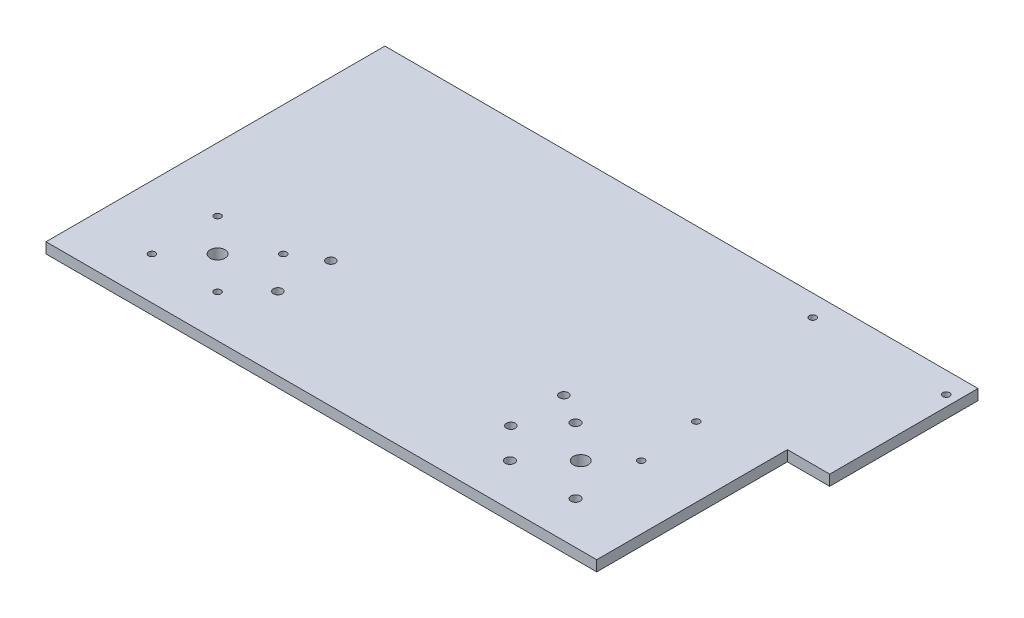
from build123d import *

# Parameters (mm, degrees)
SKETCH_1_R      = 1.6
SKETCH_1_R_2    = 3.5
SKETCH_1_R_3    = 2.1
SKETCH_1_R_4    = 2.2
EXTRUDE_1_DEPTH = 5


with BuildPart() as part:
    # 草图1 → 凸台-拉伸1 (new body)
    with BuildSketch(Plane(origin=(0, 0, 0), x_dir=(1, 0, 0), z_dir=(0, 1, 0))):
        Polygon((-140, 80), (-140, -80), (120, -80), (120, 10), (140, 10), (140, 80), align=None)
        with Locations((-110, -60)):
            Circle(SKETCH_1_R, mode=Mode.SUBTRACT)
        with Locations((-79, -60)):
            Circle(SKETCH_1_R, mode=Mode.SUBTRACT)
        with Locations((-94.5, -44.5)):
            Circle(SKETCH_1_R_2, mode=Mode.SUBTRACT)
        with Locations((-65, -45.5)):
            Circle(SKETCH_1_R_3, mode=Mode.SUBTRACT)
        with Locations((-110, -29)):
            Circle(SKETCH_1_R, mode=Mode.SUBTRACT)
        with Locations((-79, -29)):
            Circle(SKETCH_1_R, mode=Mode.SUBTRACT)
        with Locations((-65, -20.5)):
            Circle(SKETCH_1_R_3, mode=Mode.SUBTRACT)
        with Locations((59, -60)):
            Circle(SKETCH_1_R_4, mode=Mode.SUBTRACT)
        with Locations((45, -45.5)):
            Circle(SKETCH_1_R_3, mode=Mode.SUBTRACT)
        with Locations((90, -60)):
            Circle(SKETCH_1_R_4, mode=Mode.SUBTRACT)
        with Locations((75.727272727, -43.272727273)):
            Circle(SKETCH_1_R_2, mode=Mode.SUBTRACT)
        with Locations((45, -20.5)):
            Circle(SKETCH_1_R_3, mode=Mode.SUBTRACT)
        with Locations((59, -29)):
            Circle(SKETCH_1_R_4, mode=Mode.SUBTRACT)
        with Locations((90, -29)):
            Circle(SKETCH_1_R, mode=Mode.SUBTRACT)
        with Locations((87, 0)):
            Circle(SKETCH_1_R, mode=Mode.SUBTRACT)
        with Locations((72, 70)):
            Circle(SKETCH_1_R, mode=Mode.SUBTRACT)
        with Locations((135, 70)):
            Circle(SKETCH_1_R, mode=Mode.SUBTRACT)
    extrude(amount=EXTRUDE_1_DEPTH)


solid = part.part
